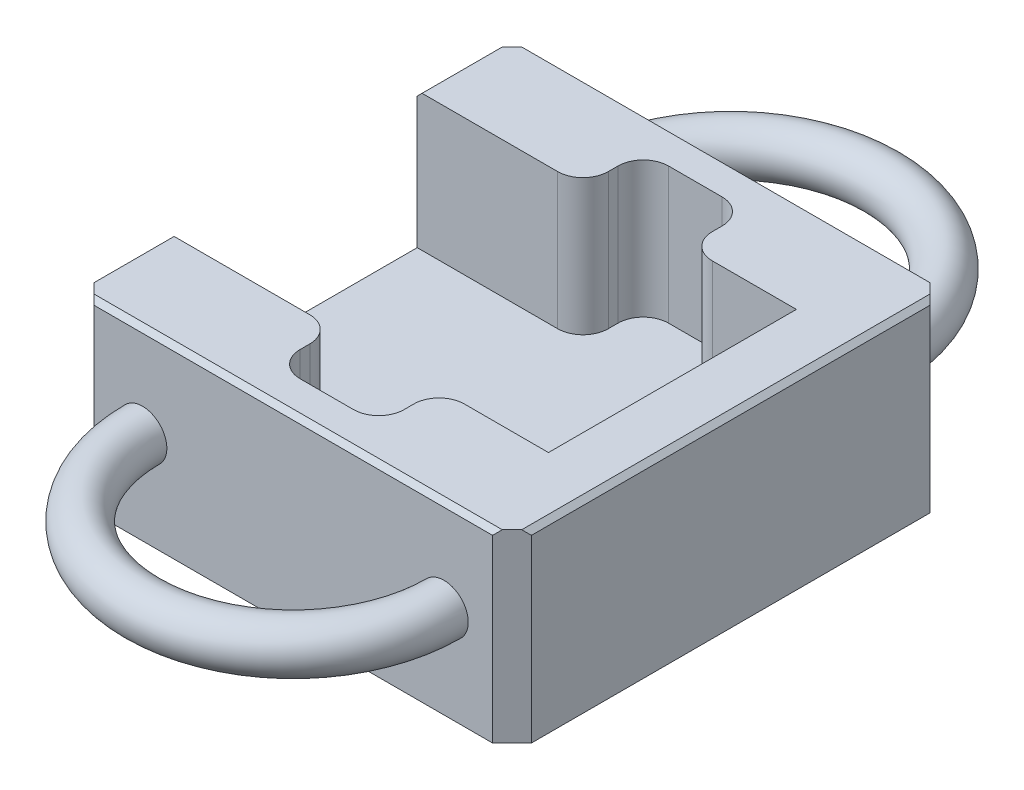
from build123d import *

# Parameters (mm, degrees)
SKETCH1_W           = 45
SKETCH1_H           = 45
BOSS_EXTRUDE1_DEPTH = 14
CUT_EXTRUDE1_DEPTH  = 35.763486592
CHAMFER1_SIZE       = 0.5
CHAMFER2_SIZE       = 2
SKETCH4_R           = 1.75
CUT_EXTRUDE2_DEPTH  = 35.763486592
SKETCH5_R           = 1.75
SKETCH5_W           = 41
SKETCH5_H           = 2
SKETCH5_W_2         = 2
SKETCH5_H_2         = 41
BOSS_EXTRUDE3_DEPTH = 5
SKETCH6_R           = 1.75
BOSS_EXTRUDE4_DEPTH = 19
REVOLVE4_OUTLINE_R  = 2.5
REVOLVE4_ANGLE      = 180


# Read off the part's stored shape, not the designer's step: Revolve4
with BuildPart() as part:
    # Sketch1 → Boss-Extrude1 (new body)
    with BuildSketch(Plane(origin=(0, 0, 0), x_dir=(1, 0, 0), z_dir=(0, 1, 0))):
        Rectangle(SKETCH1_W, SKETCH1_H)
    extrude(amount=BOSS_EXTRUDE1_DEPTH)

    # Sketch3 → Cut-Extrude1 (cut, through all)
    with BuildSketch(Plane(origin=(0, 14, 0), x_dir=(1, 0, 0), z_dir=(0, 1, 0))):
        with BuildLine():
            Line((-22.5, 12.75), (-8.05, 12.75))
            ThreePointArc((-8.05, 12.75), (-6.211522369, 13.511522369), (-5.45, 15.35))
            Line((-5.45, 15.35), (-5.45, 16.35))
            ThreePointArc((-5.45, 16.35), (-4.688477631, 18.188477631), (-2.85, 18.95))
            Line((-2.85, 18.95), (2.65, 18.95))
            ThreePointArc((2.65, 18.95), (4.488477631, 18.188477631), (5.25, 16.35))
            Line((5.25, 16.35), (5.25, 15.35))
            ThreePointArc((5.25, 15.35), (6.011522369, 13.511522369), (7.85, 12.75))
            Line((7.85, 12.75), (16.5, 12.75))
            Line((16.5, 12.75), (16.5, -12.75))
            Line((16.5, -12.75), (7.85, -12.75))
            ThreePointArc((7.85, -12.75), (6.011522369, -13.511522369), (5.25, -15.35))
            Line((5.25, -15.35), (5.25, -16.35))
            ThreePointArc((5.25, -16.35), (4.488477631, -18.188477631), (2.65, -18.95))
            Line((2.65, -18.95), (-2.85, -18.95))
            ThreePointArc((-2.85, -18.95), (-4.688477631, -18.188477631), (-5.45, -16.35))
            Line((-5.45, -16.35), (-5.45, -15.35))
            ThreePointArc((-5.45, -15.35), (-6.211522369, -13.511522369), (-8.05, -12.75))
            Line((-8.05, -12.75), (-22.5, -12.75))
            Line((-22.5, -12.75), (-22.5, 12.75))
        make_face()
    extrude(amount=-CUT_EXTRUDE1_DEPTH, mode=Mode.SUBTRACT)

    # Chamfer1
    chamfer1_edges = [part.edges().sort_by_distance(p)[0] for p in [
        (-22.5, 14, -17.625),
        (0, 14, 22.5),
        (-22.5, 14, 17.625),
        (22.5, 14, 0),
        (0, 14, -22.5),
    ]]
    chamfer(chamfer1_edges, length=CHAMFER1_SIZE)

    # Chamfer2
    # the kernel refuses this chamfer: 5.464101615, 2 mm, written as the material it takes off along each edge
    # the kernel refuses this chamfer: 5.464101615, 2 mm, written as the material it takes off along each edge
    with BuildSketch(Plane(origin=(-22.5, -5.143365976, -22.5), x_dir=(-0.027495876610585647, 0, 0.9996219169112968), z_dir=(0, 1, 0)), Plane(origin=(-22.5, -5.143365976, 22.5), x_dir=(0.9996219169112968, 0, 0.027495876610585647), z_dir=(0, 1, 0))) as chamfer2_2_piece_1:
        Polygon((CHAMFER2_SIZE * 0.999621916911, CHAMFER2_SIZE * 0.0274958766106), (-CHAMFER2_SIZE * 0.0274958766106, CHAMFER2_SIZE * 0.999621916911), (0, 0), align=None)
    extrude(amount=23.786731952, mode=Mode.SUBTRACT)
    with BuildSketch(Plane(origin=(22.5, -5.143365976, 22.5), x_dir=(-0.9996219169112968, 0, 0.027495876610585647), z_dir=(0, 1, 0)), Plane(origin=(22.5, -5.143365976, -22.5), x_dir=(0.027495876610585647, 0, 0.9996219169112968), z_dir=(0, 1, 0))) as chamfer2_2_piece_2:
        Polygon((CHAMFER2_SIZE * 0.999621916911, -CHAMFER2_SIZE * 0.0274958766106), (-CHAMFER2_SIZE * 0.0274958766106, -CHAMFER2_SIZE * 0.999621916911), (0, 0), align=None)
    extrude(amount=23.786731952, mode=Mode.SUBTRACT)

    # Sketch4 → Cut-Extrude2 (cut, through all)
    with BuildSketch(Plane(origin=(0, 14, 0), x_dir=(1, 0, 0), z_dir=(0, 1, 0))):
        with Locations(Location((-18, 17.25, 0), (0, 0, 270))):
            Circle(SKETCH4_R)
        with Locations(Location((18, 17.25, 0), (0, 0, 270))):
            Circle(SKETCH4_R)
        with Locations(Location((18, -17.25, 0), (0, 0, 270))):
            Circle(SKETCH4_R)
        with Locations(Location((-18, -17.25, 0), (0, 0, 270))):
            Circle(SKETCH4_R)
    extrude(amount=-CUT_EXTRUDE2_DEPTH, mode=Mode.SUBTRACT)

    # Sketch5 → Boss-Extrude3 (add)
    # profile 1 of 7: a face of its own
    with BuildSketch(Plane.XZ):
        with BuildLine():
            Line((20.5, 20.5), (20.5, -22.5))
            Line((20.5, -22.5), (-20.5, -22.5))
            Line((-20.5, -22.5), (-22.5, -20.5))
            Line((-22.5, -20.5), (-22.5, -12.75))
            Line((-22.5, -12.75), (-8.05, -12.75))
            ThreePointArc((-8.05, -12.75), (-6.211522369, -13.511522369), (-5.45, -15.35))
            Line((-5.45, -15.35), (-5.45, -16.35))
            ThreePointArc((-5.45, -16.35), (-4.688477631, -18.188477631), (-2.85, -18.95))
            Line((-2.85, -18.95), (2.65, -18.95))
            ThreePointArc((2.65, -18.95), (4.488477631, -18.188477631), (5.25, -16.35))
            Line((5.25, -16.35), (5.25, -15.35))
            ThreePointArc((5.25, -15.35), (6.011522369, -13.511522369), (7.85, -12.75))
            Line((7.85, -12.75), (16.5, -12.75))
            Line((16.5, -12.75), (16.5, 12.75))
            Line((16.5, 12.75), (7.85, 12.75))
            ThreePointArc((7.85, 12.75), (6.011522369, 13.511522369), (5.25, 15.35))
            Line((5.25, 15.35), (5.25, 16.35))
            ThreePointArc((5.25, 16.35), (4.488477631, 18.188477631), (2.65, 18.95))
            Line((2.65, 18.95), (-2.85, 18.95))
            ThreePointArc((-2.85, 18.95), (-4.688477631, 18.188477631), (-5.45, 16.35))
            Line((-5.45, 16.35), (-5.45, 15.35))
            ThreePointArc((-5.45, 15.35), (-6.211522369, 13.511522369), (-8.05, 12.75))
            Line((-8.05, 12.75), (-22.5, 12.75))
            Line((-22.5, 12.75), (-22.5, 20.5))
            Line((-22.5, 20.5), (20.5, 20.5))
        make_face()
        with Locations(Location((18, 17.25, 0), (0, 0, 90))):
            Circle(SKETCH5_R, mode=Mode.SUBTRACT)
        with Locations(Location((-18, -17.25, 0), (0, 0, 90))):
            Circle(SKETCH5_R, mode=Mode.SUBTRACT)
        with Locations(Location((18, -17.25, 0), (0, 0, 90))):
            Circle(SKETCH5_R, mode=Mode.SUBTRACT)
        with Locations(Location((-18, 17.25, 0), (0, 0, 90))):
            Circle(SKETCH5_R, mode=Mode.SUBTRACT)
    # profile 2 of 7: a face of its own
    with BuildSketch(Plane.XZ):
        with Locations((0, 21.5)):
            Rectangle(SKETCH5_W, SKETCH5_H)
    # profile 3 of 7: a face of its own
    with BuildSketch(Plane.XZ):
        Polygon((-22.5, 20.5), (-20.5, 20.5), (-20.5, 22.5), align=None)
    # profile 4 of 7: a face of its own
    with BuildSketch(Plane.XZ):
        Polygon((22.5, 20.5), (20.5, 20.5), (20.5, 22.5), align=None)
    # profile 5 of 7: a face of its own
    with BuildSketch(Plane.XZ):
        with Locations((21.5, 0)):
            Rectangle(SKETCH5_W_2, SKETCH5_H_2)
    # profile 6 of 7: a face of its own
    with BuildSketch(Plane.XZ):
        Polygon((20.5, -20.5), (20.5, -22.5), (22.5, -20.5), align=None)
    # profile 7 of 7: a face of its own
    with BuildSketch(Plane.XZ):
        with BuildLine():
            Line((-22.5, 12.75), (-22.5, -12.75))
            Line((-22.5, -12.75), (-8.05, -12.75))
            ThreePointArc((-8.05, -12.75), (-6.211522369, -13.511522369), (-5.45, -15.35))
            Line((-5.45, -15.35), (-5.45, -16.35))
            ThreePointArc((-5.45, -16.35), (-4.688477631, -18.188477631), (-2.85, -18.95))
            Line((-2.85, -18.95), (2.65, -18.95))
            ThreePointArc((2.65, -18.95), (4.488477631, -18.188477631), (5.25, -16.35))
            Line((5.25, -16.35), (5.25, -15.35))
            ThreePointArc((5.25, -15.35), (6.011522369, -13.511522369), (7.85, -12.75))
            Line((7.85, -12.75), (16.5, -12.75))
            Line((16.5, -12.75), (16.5, 12.75))
            Line((16.5, 12.75), (7.85, 12.75))
            ThreePointArc((7.85, 12.75), (6.011522369, 13.511522369), (5.25, 15.35))
            Line((5.25, 15.35), (5.25, 16.35))
            ThreePointArc((5.25, 16.35), (4.488477631, 18.188477631), (2.65, 18.95))
            Line((2.65, 18.95), (-2.85, 18.95))
            ThreePointArc((-2.85, 18.95), (-4.688477631, 18.188477631), (-5.45, 16.35))
            Line((-5.45, 16.35), (-5.45, 15.35))
            ThreePointArc((-5.45, 15.35), (-6.211522369, 13.511522369), (-8.05, 12.75))
            Line((-8.05, 12.75), (-22.5, 12.75))
        make_face()
    extrude(amount=BOSS_EXTRUDE3_DEPTH)

    # Sketch6 → Boss-Extrude4 (add)
    with BuildSketch(Plane(origin=(0, 14, 0), x_dir=(1, 0, 0), z_dir=(0, 1, 0))):
        with Locations((-18, 17.25)):
            Circle(SKETCH6_R)
        with Locations((18, 17.25)):
            Circle(SKETCH6_R)
        with Locations((-18, -17.25)):
            Circle(SKETCH6_R)
        with Locations((18, -17.25)):
            Circle(SKETCH6_R)
    extrude(amount=-BOSS_EXTRUDE4_DEPTH)

    # Revolve4 outline → Revolve4 (revolve)
    with BuildSketch(Plane(origin=(0, 0, 22.5), x_dir=(-1, 0, 0), z_dir=(0, 0, -1))):
        with Locations((15.5, 4.5)):
            Circle(REVOLVE4_OUTLINE_R)
    revolve4 = revolve(axis=Axis((0, 0, 22.5), (0, 1, 0)), revolution_arc=REVOLVE4_ANGLE)

    # Mirror1: Revolve4 across plane
    add(revolve4.mirror(Plane.XY))


solid = part.part
